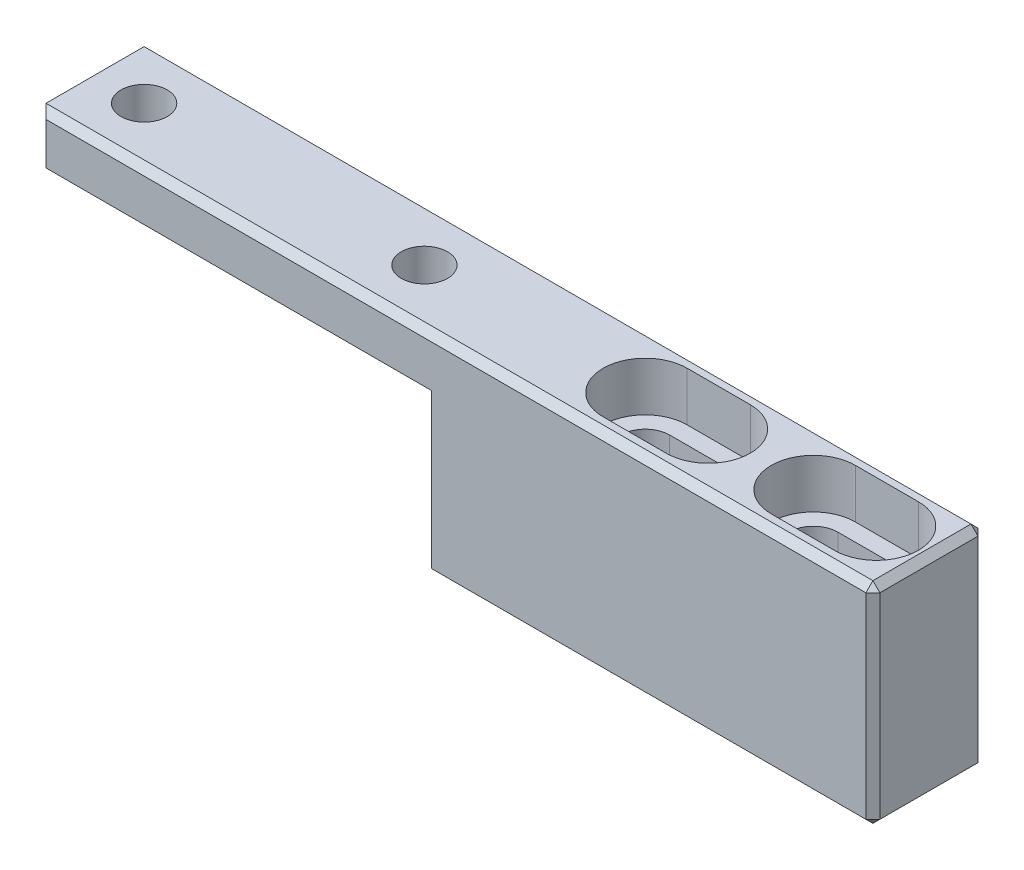
from build123d import *

# Parameters (mm, degrees)
EXTRUDE_1_DEPTH        = 8
HOLE_WIZARD_M4_1_D     = 3.3
CUT_EXTRUDE_1_DEPTH    = 3.5
CUT_EXTRUDE_2_DEPTH    = 62.613716005
PATTERN_LINEAR_1_COUNT = 2
PATTERN_LINEAR_1_PITCH = 12
CHAMFER_1_SIZE         = 1
CHAMFER_2_SIZE         = 0.5
PATTERN_LINEAR_2_COUNT = 2
PATTERN_LINEAR_2_PITCH = 20


with BuildPart() as part:
    # 草图1 → 凸台-拉伸1 (new body)
    with BuildSketch(Plane.XY):
        Polygon((0, 0), (-32, 0), (-32, 11), (-60, 11), (-60, 15), (0, 15), align=None)
    extrude(amount=EXTRUDE_1_DEPTH)

    # M4 螺纹孔1 (through all)
    with Locations(Plane(origin=(0, 15, 0), x_dir=(-1, 0, 0), z_dir=(0, 1, 0))):
        with Locations((56, 4)):
            hole_wizard_m4_1 = Hole(HOLE_WIZARD_M4_1_D / 2)

    # 草图4 → 切除-拉伸1 (cut)
    with BuildSketch(Plane(origin=(0, 15, 0), x_dir=(1, 0, 0), z_dir=(0, 1, 0))):
        with BuildLine():
            Line((-15.75, -7), (-20.25, -7))
            ThreePointArc((-20.25, -7), (-23.25, -4), (-20.25, -1))
            Line((-20.25, -1), (-15.75, -1))
            ThreePointArc((-15.75, -1), (-12.75, -4), (-15.75, -7))
        make_face()
    cut_extrude_1 = extrude(amount=-CUT_EXTRUDE_1_DEPTH, mode=Mode.SUBTRACT)

    # 草图5 → 切除-拉伸2 (cut, through all)
    with BuildSketch(Plane(origin=(0, 11.5, 0), x_dir=(1, 0, 0), z_dir=(0, 1, 0))):
        with BuildLine():
            Line((-20.25, -5.75), (-15.75, -5.75))
            ThreePointArc((-15.75, -5.75), (-14, -4), (-15.75, -2.25))
            Line((-15.75, -2.25), (-20.25, -2.25))
            ThreePointArc((-20.25, -2.25), (-22, -4), (-20.25, -5.75))
        make_face()
    cut_extrude_2 = extrude(amount=-CUT_EXTRUDE_2_DEPTH, mode=Mode.SUBTRACT)

    # 阵列(线性)1: 切除-拉伸1, 切除-拉伸2 ×2
    with Locations(*[(i * PATTERN_LINEAR_1_PITCH, 0, 0) for i in range(1, PATTERN_LINEAR_1_COUNT)]):
        add(cut_extrude_1, mode=Mode.SUBTRACT)
        add(cut_extrude_2, mode=Mode.SUBTRACT)

    # 倒角1
    chamfer_1_edges = [part.edges().sort_by_distance(p)[0] for p in [
        (-60, 13, 8),
        (-60, 13, 0),
    ]]
    chamfer(chamfer_1_edges, length=CHAMFER_1_SIZE)

    # 倒角2
    chamfer_2_edges = [part.edges().sort_by_distance(p)[0] for p in [
        (0, 0, 4),
        (-32, 5.5, 8),
        (-16, 0, 8),
        (0, 7.5, 8),
        (-32, 5.5, 0),
        (-16, 0, 0),
        (0, 7.5, 0),
        (-29.5, 15, 0),
        (0, 15, 4),
        (-29.5, 15, 8),
        (-60, 11, 4),
        (-60, 15, 4),
        (-45.5, 11, 8),
        (-32, 0, 4),
        (-45.5, 11, 0),
    ]]
    chamfer(chamfer_2_edges, length=CHAMFER_2_SIZE - 0.0001)  # a hair under: the kernel refuses the full size

    # 阵列(线性)2: M4 螺纹孔1 ×2
    with Locations(*[(i * PATTERN_LINEAR_2_PITCH, 0, 0) for i in range(1, PATTERN_LINEAR_2_COUNT)]):
        add(hole_wizard_m4_1, mode=Mode.SUBTRACT)


solid = part.part
